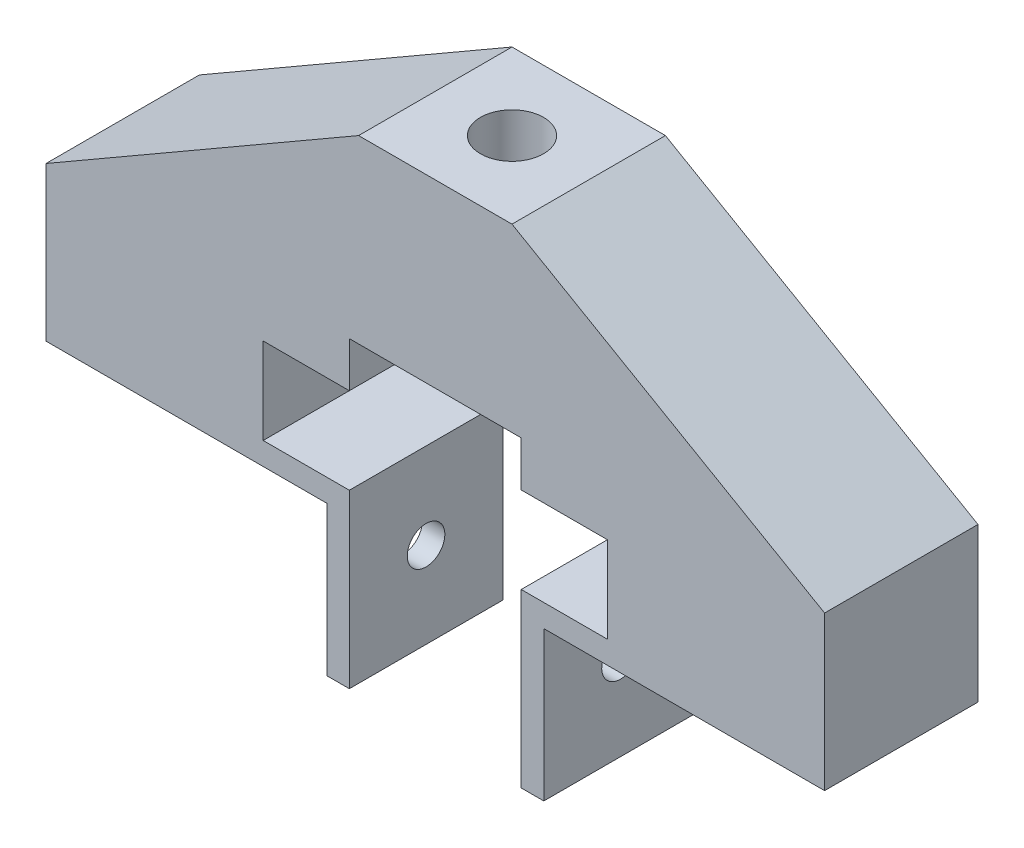
from build123d import *

# Parameters (mm, degrees)
BOSS_EXTRUDE1_DEPTH = 34
SKETCH2_R           = 7
CUT_EXTRUDE1_DEPTH  = 35
SKETCH3_R           = 4.1656
CUT_EXTRUDE2_DEPTH  = 138.185886126


with BuildPart() as part:
    # Sketch1 → Boss-Extrude1 (new body)
    with BuildSketch(Plane.XY):
        Polygon((-86.282032303, 0), (-24.05, 0), (-24.05, -33.1), (-19.05, -33.1), (-19.05, 5), (-38.15, 5), (-38.15, 24.1), (-19.05, 24.1), (-19.05, 34.1), (19.05, 34.1), (19.05, 24.1), (38.15, 24.1), (38.15, 5), (19.05, 5), (19.05, -33.1), (24.05, -33.1), (24.05, 0), (86.282032303, 0), (86.282032303, 34.1), (17, 74.1), (-17, 74.1), (-86.282032303, 34.1), align=None)
    extrude(amount=BOSS_EXTRUDE1_DEPTH)

    # Sketch2 → Cut-Extrude1 (cut)
    with BuildSketch(Plane(origin=(0, 74.1, 0), x_dir=(1, 0, 0), z_dir=(0, 1, 0))):
        with Locations((0, -17)):
            Circle(SKETCH2_R)
    extrude(amount=-CUT_EXTRUDE1_DEPTH, mode=Mode.SUBTRACT)

    # Sketch3 → Cut-Extrude2 (cut, through all)
    with BuildSketch(Plane(origin=(24.05, 0, 0), x_dir=(0, 0, -1), z_dir=(1, 0, 0))):
        with Locations((-17, -14.05)):
            Circle(SKETCH3_R)
    extrude(amount=-CUT_EXTRUDE2_DEPTH, mode=Mode.SUBTRACT)


solid = part.part
